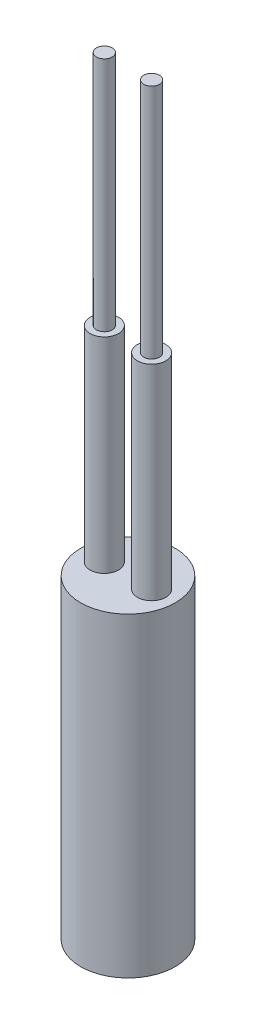
from build123d import *

# Parameters (mm, degrees)
SKETCH1_R           = 3
BOSS_EXTRUDE1_DEPTH = 20
SKETCH2_R           = 0.9
BOSS_EXTRUDE2_DEPTH = 13
SKETCH3_R           = 0.5
BOSS_EXTRUDE3_DEPTH = 15


with BuildPart() as part:
    # Sketch1 → Boss-Extrude1 (new body)
    with BuildSketch(Plane(origin=(0, 0, 0), x_dir=(1, 0, 0), z_dir=(0, 1, 0))):
        Circle(SKETCH1_R)
    extrude(amount=BOSS_EXTRUDE1_DEPTH)

    # Sketch2 → Boss-Extrude2 (add)
    with BuildSketch(Plane(origin=(0, 20, 0), x_dir=(1, 0, 0), z_dir=(0, 1, 0))):
        with Locations((1.5, 0)):
            Circle(SKETCH2_R)
        with Locations((-1.5, 0)):
            Circle(SKETCH2_R)
    extrude(amount=BOSS_EXTRUDE2_DEPTH)

    # Sketch3 → Boss-Extrude3 (add)
    with BuildSketch(Plane(origin=(0, 33, 0), x_dir=(1, 0, 0), z_dir=(0, 1, 0))):
        with Locations((1.5, 0)):
            Circle(SKETCH3_R)
        with Locations((-1.5, 0)):
            Circle(SKETCH3_R)
    extrude(amount=BOSS_EXTRUDE3_DEPTH)


solid = part.part
